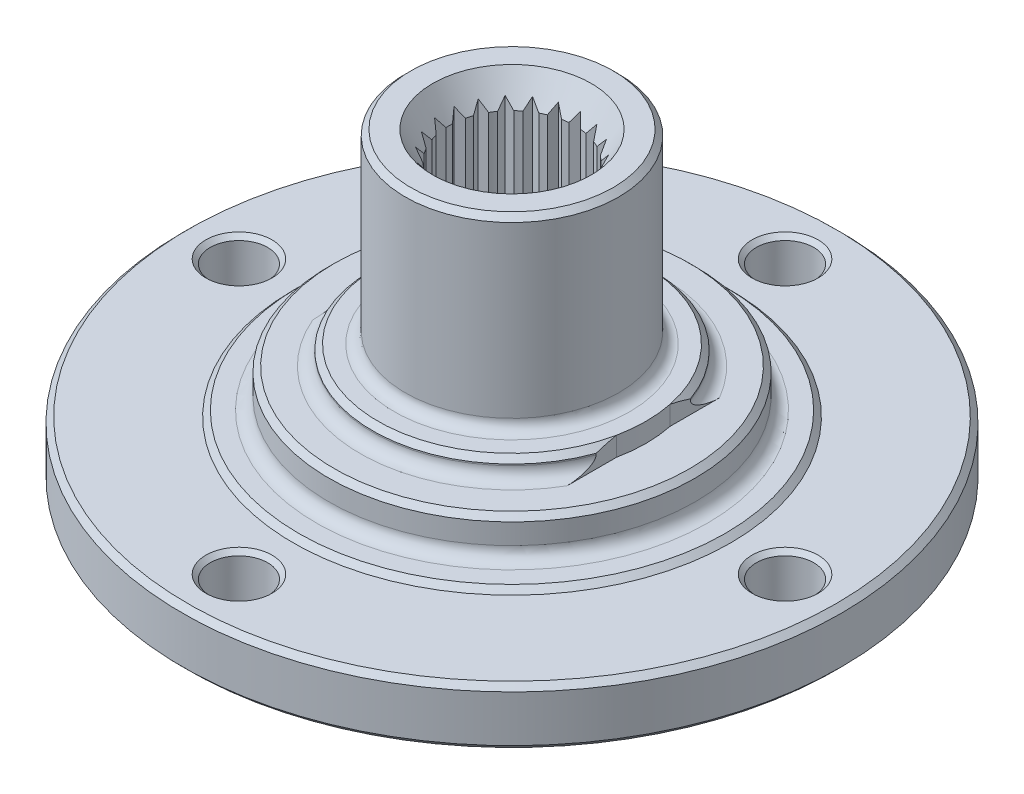
from build123d import *

# Parameters (mm, degrees)
CHANFRO1_SIZE         = 1
FILETE1_R             = 2
FILETE2_R             = 2.25
FILETE3_R             = 3.5
FILETE4_R             = 3
CHANFRO2_SIZE         = 1
FILETE5_R             = 2
CHANFRO3_SIZE         = 1.5
ESBO_O2_W             = 36.293032956
ESBO_O2_H             = 41.195355304
CORTE_EXTRUS_O1_DEPTH = 3.5
CORTE_EXTRUS_O3_DEPTH = 115.5092791
ESBO_O5_R             = 5.25
ESBO_O5_R_2           = 3.25
CORTE_EXTRUS_O4_DEPTH = 102.961389751
CHANFRO4_SIZE         = 0.8


with BuildPart() as part:
    # Esboço1 → Revolução1 (revolve)
    with BuildSketch(Plane.XY, mode=Mode.PRIVATE) as revolu_o1_sk:
        Polygon((11.5, 44.911528822), (14.5, 50.107681245), (19.5, 50.107681245), (19.5, 16.107681245), (25.5, 16.107681245), (25.5, 12.607681245), (33.5, 12.607681245), (33.5, 5.607681245), (40, 5.607681245), (40, 4.607681245), (60.25, 4.607681245), (60.25, -5.892318755), (32.5, -5.892318755), (32.5, -10.892318755), (28.5, -10.892318755), (28.5, -26.392318755), (25.5, -26.392318755), (25.5, -18.762218045), (23.5, -18.762218045), (23.5, -10.780952381), (13, -10.780952381), (13, -10.280952381), (11.5, -10.280952381), align=None)
    revolve(revolu_o1_sk.sketch.rotate(Axis((0, 53.156665985, 0), (0, -1, 0)), 180), axis=Axis((0, 53.156665985, 0), (0, -1, 0)))

    # Chanfro1
    chanfro1_edges = [part.edges().sort_by_distance(p)[0] for p in [
        (60.25, -5.892318755, 0),
        (60.25, 4.607681245, 0),
        (40, 5.607681245, 0),
        (33.5, 12.607681245, 0),
        (25.5, 16.107681245, 0),
        (19.5, 50.107681245, 0),
    ]]
    chamfer(chanfro1_edges, length=CHANFRO1_SIZE - 0.0001)  # a hair under: the kernel refuses the full size

    # Filete1
    filete1_edges = [part.edges().sort_by_distance(p)[0] for p in [
        (19.5, 16.107681245, 0),
    ]]
    fillet(filete1_edges, radius=FILETE1_R)

    # Filete2
    filete2_edges = [part.edges().sort_by_distance(p)[0] for p in [
        (33.5, 5.607681245, 0),
        (25.5, 12.607681245, 0),
    ]]
    fillet(filete2_edges, radius=FILETE2_R)

    # Filete3
    filete3_edges = [part.edges().sort_by_distance(p)[0] for p in [
        (28.5, -10.892318755, 0),
    ]]
    fillet(filete3_edges, radius=FILETE3_R)

    # Filete4
    filete4_edges = [part.edges().sort_by_distance(p)[0] for p in [
        (32.5, -5.892318755, 0),
    ]]
    fillet(filete4_edges, radius=FILETE4_R)

    # Chanfro2
    chanfro2_edges = [part.edges().sort_by_distance(p)[0] for p in [
        (25.5, -26.392318755, 0),
        (28.5, -26.392318755, 0),
    ]]
    chamfer(chanfro2_edges, length=CHANFRO2_SIZE)

    # Filete5
    filete5_edges = [part.edges().sort_by_distance(p)[0] for p in [
        (23.5, -10.780952381, 0),
        (25.5, -18.762218045, 0),
    ]]
    fillet(filete5_edges, radius=FILETE5_R - 0.0001)  # a hair under: the kernel refuses the full size

    # Chanfro3
    chanfro3_edges = [part.edges().sort_by_distance(p)[0] for p in [
        (11.5, -10.280952381, 0),
    ]]
    chamfer(chanfro3_edges, length=CHANFRO3_SIZE - 0.0001)  # a hair under: the kernel refuses the full size

    # Esboço2 → Corte-extrusão1 (cut)
    with BuildSketch(Plane(origin=(0, 16.107681245, 0), x_dir=(1, 0, 0), z_dir=(0, 1, 0))):
        with Locations((-43.646516478, 0)):
            Rectangle(ESBO_O2_W, ESBO_O2_H)
        with BuildLine():
            Line((24, 20.597677652), (24, 4.924926396))
            ThreePointArc((24, 4.924926396), (24.374754358, 2.47512626), (24.5001, 0))
            ThreePointArc((24.5001, 0), (24.374754358, -2.47512626), (24, -4.924926396))
            Line((24, -4.924926396), (24, -20.597677652))
            Line((24, -20.597677652), (60.293032956, -20.597677652))
            Line((60.293032956, -20.597677652), (60.293032956, 20.597677652))
            Line((60.293032956, 20.597677652), (24, 20.597677652))
        make_face()
    extrude(amount=-CORTE_EXTRUS_O1_DEPTH, mode=Mode.SUBTRACT)

    # Esboço4 → Corte-extrusão3 (cut, through all)
    with BuildSketch(Plane(origin=(0, 50.107681245, 0), x_dir=(1, 0, 0), z_dir=(0, 1, 0))):
        Polygon((0, 12.5), (-1.348647536, 11.151352464), (1.348647536, 11.151352464), align=None)
        Polygon((3.521656961, 11.99366217), (1.847681208, 11.079602254), (4.435716876, 10.319686417), align=None)
        Polygon((6.758010218, 10.51566916), (4.894321808, 10.110248563), (7.163430816, 8.65198075), align=None)
        Polygon((9.446869679, 8.185759174), (7.544453563, 8.32182266), (9.310806193, 6.283343058), align=None)
        Polygon((11.370399942, 5.192687663), (9.583378559, 5.859212178), (10.703875427, 3.40566628), align=None)
        Polygon((12.372768024, 1.778935478), (10.845915219, 2.921923171), (11.229780331, 0.252082674), align=None)
        Polygon((12.372768024, -1.778935478), (11.229780331, -0.252082674), (10.845915219, -2.921923171), align=None)
        Polygon((11.370399942, -5.192687663), (10.703875427, -3.40566628), (9.583378559, -5.859212178), align=None)
        Polygon((9.446869679, -8.185759174), (9.310806193, -6.283343058), (7.544453563, -8.32182266), align=None)
        Polygon((6.758010218, -10.51566916), (7.163430816, -8.65198075), (4.894321808, -10.110248563), align=None)
        Polygon((3.521656961, -11.99366217), (4.435716876, -10.319686417), (1.847681208, -11.079602254), align=None)
        Polygon((0, -12.5), (1.348647536, -11.151352464), (-1.348647536, -11.151352464), align=None)
        Polygon((-3.521656961, -11.99366217), (-1.847681208, -11.079602254), (-4.435716876, -10.319686417), align=None)
        Polygon((-6.758010218, -10.51566916), (-4.894321808, -10.110248563), (-7.163430816, -8.65198075), align=None)
        Polygon((-9.446869679, -8.185759174), (-7.544453563, -8.32182266), (-9.310806193, -6.283343058), align=None)
        Polygon((-11.370399942, -5.192687663), (-9.583378559, -5.859212178), (-10.703875427, -3.40566628), align=None)
        Polygon((-12.372768024, -1.778935478), (-10.845915219, -2.921923171), (-11.229780331, -0.252082674), align=None)
        Polygon((-12.372768024, 1.778935478), (-11.229780331, 0.252082674), (-10.845915219, 2.921923171), align=None)
        Polygon((-11.370399942, 5.192687663), (-10.703875427, 3.40566628), (-9.583378559, 5.859212178), align=None)
        Polygon((-9.446869679, 8.185759174), (-9.310806193, 6.283343058), (-7.544453563, 8.32182266), align=None)
        Polygon((-6.758010218, 10.51566916), (-7.163430816, 8.65198075), (-4.894321808, 10.110248563), align=None)
        Polygon((-3.521656961, 11.99366217), (-4.435716876, 10.319686417), (-1.847681208, 11.079602254), align=None)
    extrude(amount=-CORTE_EXTRUS_O3_DEPTH, mode=Mode.SUBTRACT)

    # Esboço5 → Corte-extrusão4 (cut, through all)
    with BuildSketch(Plane.XZ.offset(5.892318755)):
        with Locations((-49.920135794, 0)):
            Circle(ESBO_O5_R)
        with Locations((-35.298866538, -35.298866538)):
            Circle(ESBO_O5_R_2)
        with Locations((0, 49.920135794)):
            Circle(ESBO_O5_R)
        with Locations((49.920135794, 0)):
            Circle(ESBO_O5_R)
        with Locations((0, -49.920135794)):
            Circle(ESBO_O5_R)
    extrude(amount=-CORTE_EXTRUS_O4_DEPTH, mode=Mode.SUBTRACT)

    # Chanfro4
    chanfro4_edges = [part.edges().sort_by_distance(p)[0] for p in [
        (-55.170135794, 4.607681245, 0),
        (-55.170135794, -5.892318755, 0),
        (-38.548866538, 4.607681245, -35.298866538),
        (-38.548866538, -5.892318755, -35.298866538),
        (-5.25, 4.607681245, 49.920135794),
        (-5.25, -5.892318755, 49.920135794),
        (44.670135794, 4.607681245, 0),
        (44.670135794, -5.892318755, 0),
        (-5.25, 4.607681245, -49.920135794),
        (-5.25, -5.892318755, -49.920135794),
    ]]
    chamfer(chanfro4_edges, length=CHANFRO4_SIZE)


solid = part.part
